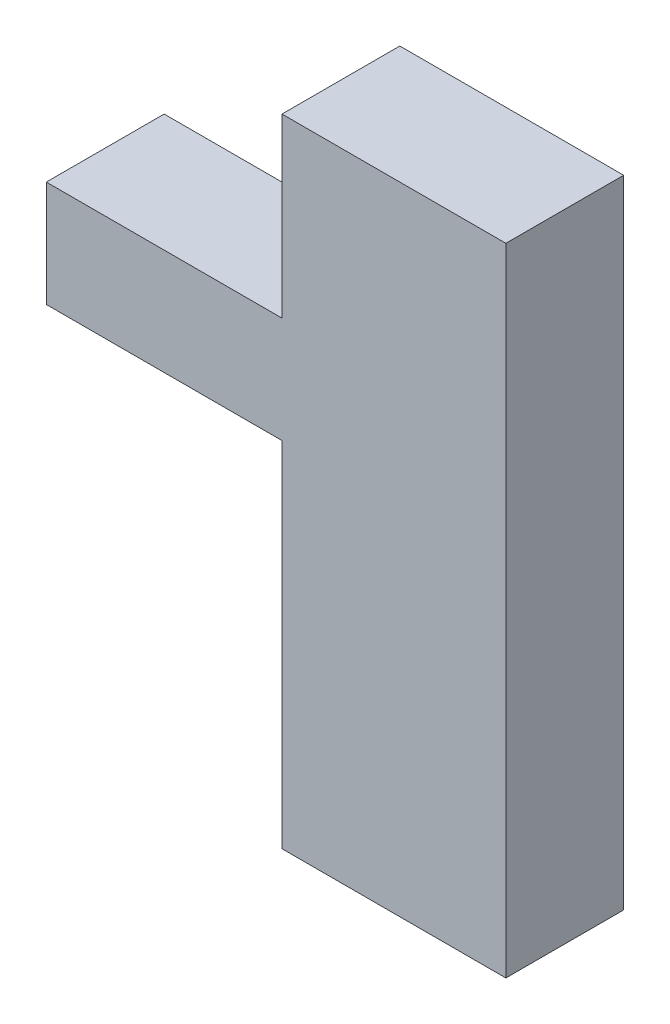
from build123d import *

# Parameters (mm, degrees)
BOSS_EXTRUDE1_DEPTH = 4


with BuildPart() as part:
    # Sketch1 → Boss-Extrude1 (new body)
    with BuildSketch(Plane.XY):
        Polygon((0.2, 0.2), (7.8, 0.2), (7.8, 21.8), (0.2, 21.8), (0.2, 15.8), (-7.8, 15.8), (-7.8, 12.2), (0.2, 12.2), align=None)
    extrude(amount=BOSS_EXTRUDE1_DEPTH)


solid = part.part
